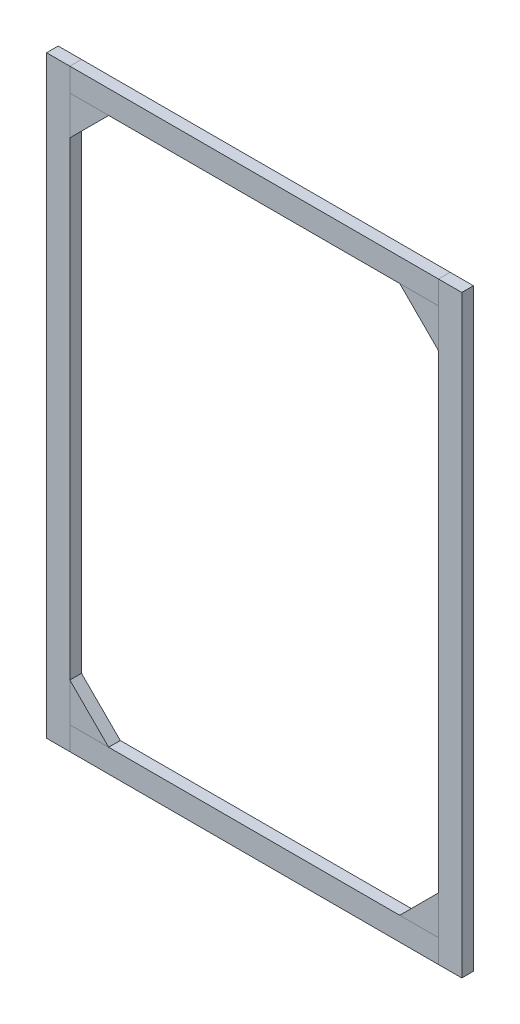
from build123d import *

# Parameters (mm, degrees)
MEMBER_START                 = -765
MEMBER_20_X_20_1_OUTLINE_W   = 60
MEMBER_20_X_20_1_OUTLINE_H   = 30
MEMBER_20_X_20_1_DEPTH       = 1530
MEMBER_20_X_20_1_2_OUTLINE_W = 950
MEMBER_20_X_20_1_2_OUTLINE_H = 30
MEMBER_20_X_20_1_2_DEPTH     = 60
MEMBER_START_2               = 705
MEMBER_20_X_20_1_3_OUTLINE_W = 950
MEMBER_20_X_20_1_3_OUTLINE_H = 30
MEMBER_20_X_20_1_3_DEPTH     = 60
GUSSET_1_THICKNESS           = 30


# Read off the part's stored shape, not the designer's step: Квадрат 20 X 20(1)
with BuildPart() as part:
    # Member 20 X 20_1 outline → Member 20 X 20_1 (new body)
    with BuildSketch(Plane(origin=(0, 0, 0), x_dir=(1, 0, 0), z_dir=(0, 1, 0)).offset(MEMBER_START)):
        with Locations((505, 0)):
            Rectangle(MEMBER_20_X_20_1_OUTLINE_W, MEMBER_20_X_20_1_OUTLINE_H)
        with Locations((-505, 0)):
            Rectangle(MEMBER_20_X_20_1_OUTLINE_W, MEMBER_20_X_20_1_OUTLINE_H)
    extrude(amount=MEMBER_20_X_20_1_DEPTH)


with BuildPart() as body_2:
    # Member 20 X 20_1 2 outline → Member 20 X 20_1 2 (new body)
    with BuildSketch(Plane(origin=(0, 0, 0), x_dir=(1, 0, 0), z_dir=(0, 1, 0)).offset(MEMBER_START)):
        Rectangle(MEMBER_20_X_20_1_2_OUTLINE_W, MEMBER_20_X_20_1_2_OUTLINE_H)
    extrude(amount=MEMBER_20_X_20_1_2_DEPTH)


with BuildPart() as body_3:
    # Member 20 X 20_1 3 outline → Member 20 X 20_1 3 (new body)
    with BuildSketch(Plane(origin=(0, 0, 0), x_dir=(1, 0, 0), z_dir=(0, 1, 0)).offset(MEMBER_START_2)):
        Rectangle(MEMBER_20_X_20_1_3_OUTLINE_W, MEMBER_20_X_20_1_3_OUTLINE_H)
    extrude(amount=MEMBER_20_X_20_1_3_DEPTH)


with BuildPart() as body_4:
    # Gusset 1: a gusset: a plate 30.0 thick in the corner of two members, its outline drawn in place
    gusset_1_outline = Wire([Line((-475, 705, -15), (-375, 705, -15)), Line((-375, 705, -15), (-475, 605, -15)), Line((-475, 605, -15), (-475, 705, -15))])
    add(extrude(Face(gusset_1_outline), amount=GUSSET_1_THICKNESS, dir=(0, 0, 1)))


with BuildPart() as body_5:
    # Зеркальное отражение2: mirrored copy
    add(body_4.part.mirror(Plane(origin=(0, 0, 0), x_dir=(0, 0, 1), z_dir=(1, 0, 0))))


with BuildPart() as body_6:
    # Зеркальное отражение3: mirrored copy
    add(body_4.part.mirror(Plane.ZX))


with BuildPart() as body_7:
    # Mirror 3 2: mirrored copy
    add(body_5.part.mirror(Plane.ZX))


solid = Compound([part.part, body_2.part, body_3.part, body_4.part, body_5.part, body_6.part, body_7.part])
